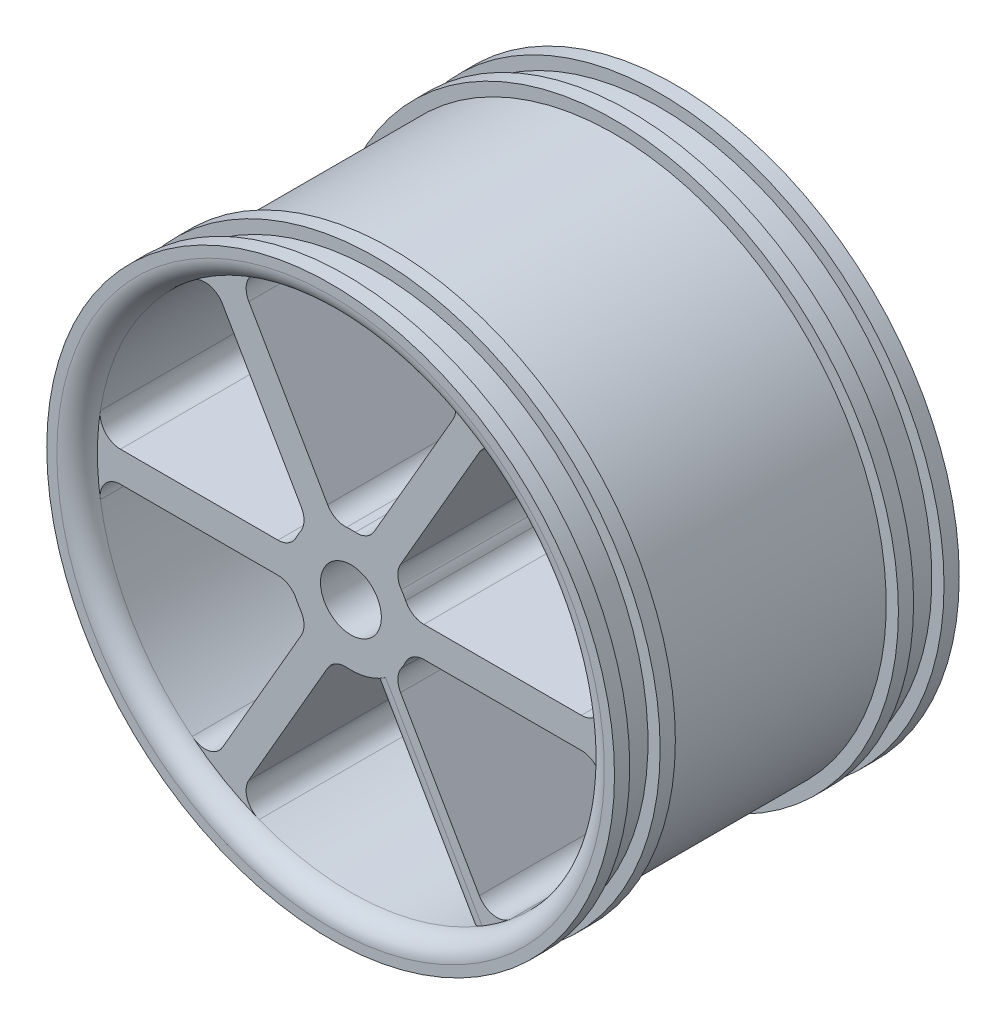
from build123d import *

# Parameters (mm, degrees)
SKETCH2_W           = 25
SKETCH2_H           = 3
BOSS_EXTRUDE1_DEPTH = 32
CIRPATTERN1_COUNT   = 6
SKETCH5_R           = 6
BOSS_EXTRUDE2_DEPTH = 32
SKETCH6_R           = 3
AXLEHOLE_DEPTH      = 53.191951405
FILLET1_R           = 2


with BuildPart() as part:
    # Sketch1 → Revolve1 (revolve)
    with BuildSketch(Plane.XZ, mode=Mode.PRIVATE) as revolve1_sk:
        with BuildLine():
            Line((25, 0), (28, 0))
            Line((28, 0), (28, 1.5))
            Line((28, 1.5), (26.8, 1.5))
            Line((26.8, 1.5), (26.8, 4.5))
            Line((26.8, 4.5), (28, 4.5))
            Line((28, 4.5), (28, 6))
            Line((28, 6), (26.8, 6))
            Line((26.8, 6), (26.8, 28))
            Line((26.8, 28), (28, 28))
            Line((28, 28), (28, 29.5))
            Line((28, 29.5), (26.8, 29.5))
            Line((26.8, 29.5), (26.8, 32.5))
            Line((26.8, 32.5), (28, 32.5))
            Line((28, 32.5), (28, 33.999996833))
            Line((28, 33.999996833), (27, 33.999996833))
            ThreePointArc((27, 33.999996833), (25.585786438, 33.414213562), (25, 32))
            Line((25, 32), (25, 0))
        make_face()
    revolve(revolve1_sk.sketch.rotate(Axis((0, 0, 34), (0, 0, -1)), 180), axis=Axis((0, 0, 34), (0, 0, -1)))

    # Sketch2 → Boss-Extrude1 (add)
    with BuildSketch(Plane.XY):
        with Locations((12.5, 0)):
            Rectangle(SKETCH2_W, SKETCH2_H)
    boss_extrude1 = extrude(amount=BOSS_EXTRUDE1_DEPTH)

    # CirPattern1: Boss-Extrude1 ×6 about axis
    cirpattern1_axis = Axis((0, 0, 0), (0, 0, 1))
    for i in range(1, CIRPATTERN1_COUNT):
        add(boss_extrude1.rotate(cirpattern1_axis, i * 360 / CIRPATTERN1_COUNT))

    # Sketch5 → Boss-Extrude2 (add)
    with BuildSketch(Plane.XY):
        Circle(SKETCH5_R)
    extrude(amount=BOSS_EXTRUDE2_DEPTH)

    # Sketch6 → AxleHole (cut, through all)
    with BuildSketch(Plane.XY):
        with Locations(Location((0, 0, 0), (0, 0, 180))):
            Circle(SKETCH6_R)
    extrude(amount=AXLEHOLE_DEPTH, mode=Mode.SUBTRACT)

    # Fillet1
    # the kernel refuses this fillet: 2 mm, written as the material it adds along each edge
    with BuildSketch(Plane(origin=(-24.954959427, -1.5, 32), x_dir=(0.10620109039764976, -0.9943446728365121, 0), z_dir=(0, 0, -1))) as fillet1_piece_1:
        with BuildLine():
            CenterArc((2.224755634, -1.997850608), FILLET1_R, 87.343441845, 98.752929077)
            Line((0.236066288, -2.210252789), (0, 0))
            ThreePointArc((0, 0), (1.158726893, 0.026867397), (2.317453785, 0))
        make_face()
    extrude(amount=32)
    with BuildSketch(Plane(origin=(-13.776517819, -20.861628814, 32), x_dir=(-0.8080272015953212, 0.589145178612228, 0), z_dir=(0, 0, -1)), Plane(origin=(13.776517819, 20.861628814, 32), x_dir=(0.8080272015953204, -0.589145178612229, 0), z_dir=(0, 0, -1)), Plane(origin=(24.954959427, -1.5, 32), x_dir=(-0.10620109039765001, -0.994344672836512, 0), z_dir=(0, 0, -1)), Plane(origin=(-11.178441608, 22.361628814, 32), x_dir=(0.9142282919929711, 0.4051994942242834, 0), z_dir=(0, 0, -1)), Plane(origin=(-24.954959427, 1.5, 32), x_dir=(0.10620109039765026, 0.994344672836512, 0), z_dir=(0, 0, -1))) as fillet1_piece_2:
        with BuildLine():
            CenterArc((2.224755634, 1.997850608), FILLET1_R, 173.903629078, 98.752929077)
            Line((0.236066288, 2.210252789), (0, 0))
            ThreePointArc((0, 0), (1.158726893, -0.026867397), (2.317453785, 0))
        make_face()
    extrude(amount=32)
    with BuildSketch(Plane(origin=(-11.178441608, -22.361628814, 32), x_dir=(0.5000000000000002, 0.8660254037844387, 0), z_dir=(0, 0, -1)), Plane(origin=(13.776517819, -20.861628814, 32), x_dir=(-0.5000000000000002, 0.8660254037844387, 0), z_dir=(0, 0, -1)), Plane(origin=(24.954959427, 1.5, 32), x_dir=(-1, 0, 0), z_dir=(0, 0, -1)), Plane(origin=(11.178441608, 22.361628814, 32), x_dir=(-0.4999999999999994, -0.8660254037844389, 0), z_dir=(0, 0, -1)), Plane(origin=(-13.776517819, 20.861628814, 32), x_dir=(0.5000000000000007, -0.8660254037844382, 0), z_dir=(0, 0, -1))) as fillet1_piece_3:
        with BuildLine():
            CenterArc((2.222823584, 2), FILLET1_R, 171.247070923, 98.752929077)
            ThreePointArc((0.246116119, 2.304347826), (0.096342606, 1.15502726), (0, 0))
            Line((0, 0), (2.222823584, 0))
        make_face()
    extrude(amount=32)
    with BuildSketch(Plane(origin=(5.809475019, 1.5, 32), x_dir=(1, 0, 0), z_dir=(0, 0, -1)), Plane(origin=(4.203775615, -4.281152949, 32), x_dir=(0.5000000000000001, -0.8660254037844386, 0), z_dir=(0, 0, -1)), Plane(origin=(1.605699404, 5.781152949, 32), x_dir=(0.4999999999999986, 0.8660254037844394, 0), z_dir=(0, 0, -1)), Plane(origin=(-4.203775615, 4.281152949, 32), x_dir=(-0.5000000000000004, 0.8660254037844384, 0), z_dir=(0, 0, -1)), Plane(origin=(-5.809475019, -1.5, 32), x_dir=(-1, 0, 0), z_dir=(0, 0, -1)), Plane(origin=(-1.605699404, -5.781152949, 32), x_dir=(-0.4999999999999988, -0.8660254037844393, 0), z_dir=(0, 0, -1))) as fillet1_piece_4:
        with BuildLine():
            CenterArc((1.384272266, -2), FILLET1_R, 90, 64.055520228)
            ThreePointArc((-0.414164556, -1.125), (-0.178914596, -0.572869827), (0, 0))
            Line((0, 0), (1.384272266, 0))
        make_face()
    extrude(amount=32)
    with BuildSketch(Plane(origin=(4.203775615, 4.281152949, 32), x_dir=(0.6399622417657335, -0.7684063567632539, 0), z_dir=(0, 0, -1)), Plane(origin=(5.809475019, -1.5, 32), x_dir=(-0.3454783045035584, -0.9384267372135913, 0), z_dir=(0, 0, -1)), Plane(origin=(-1.605699404, 5.781152949, 32), x_dir=(0.9854405462692932, 0.1700203804503366, 0), z_dir=(0, 0, -1)), Plane(origin=(-5.809475019, 1.5, 32), x_dir=(0.3454783045035597, 0.9384267372135907, 0), z_dir=(0, 0, -1))) as fillet1_piece_5:
        with BuildLine():
            CenterArc((1.398617439, -1.989994715), FILLET1_R, 95.733483793, 64.055520228)
            Line((-0.478236035, -1.299038106), (0, 0))
            ThreePointArc((0, 0), (0.599407474, -0.030015856), (1.198814948, 0))
        make_face()
    extrude(amount=32)
    with BuildSketch(Plane(origin=(-4.203775615, -4.281152949, 32), x_dir=(-0.4999999999999996, -0.8660254037844388, 0), z_dir=(0, 0, -1))) as fillet1_piece_6:
        with BuildLine():
            CenterArc((1.384272266, 2), FILLET1_R, 205.944479772, 64.055520228)
            ThreePointArc((-0.414164556, 1.125), (-0.178914596, 0.572869827), (0, 0))
            Line((0, 0), (1.384272266, 0))
        make_face()
    extrude(amount=32)
    # the kernel refuses this fillet: 2 mm, written as the material it takes off along each edge
    with BuildSketch(Plane(origin=(-0.894300596, -1.45102593, 32), x_dir=(0.8660254037844385, 0.5000000000000003, 0), z_dir=(0.5000000000000003, -0.8660254037844386, 0))) as fillet1_2_piece_1_section:
        with BuildLine():
            CenterArc((FILLET1_R, -FILLET1_R), FILLET1_R, 90, 90)
            Line((0, -FILLET1_R), (0, 0))
            Line((0, 0), (FILLET1_R, 0))
        make_face()
    fillet1_2_piece_1 = extrude(amount=29.145484408, mode=Mode.PRIVATE)
    fillet1_2_piece_1 = fillet1_2_piece_1 & Plane(origin=(0, 0, 31.552739603), x_dir=(-1, 0, 0), z_dir=(0, 0, -1)) * Cylinder(25, 67, mode=Mode.PRIVATE)
    fillet1_2_piece_1 = fillet1_2_piece_1 - Plane(origin=(0, 0, 31.552739603), x_dir=(1, 0, 0), z_dir=(0, 0, -1)) * Cylinder(6, 67, mode=Mode.PRIVATE)
    add(fillet1_2_piece_1, mode=Mode.SUBTRACT)


solid = part.part
